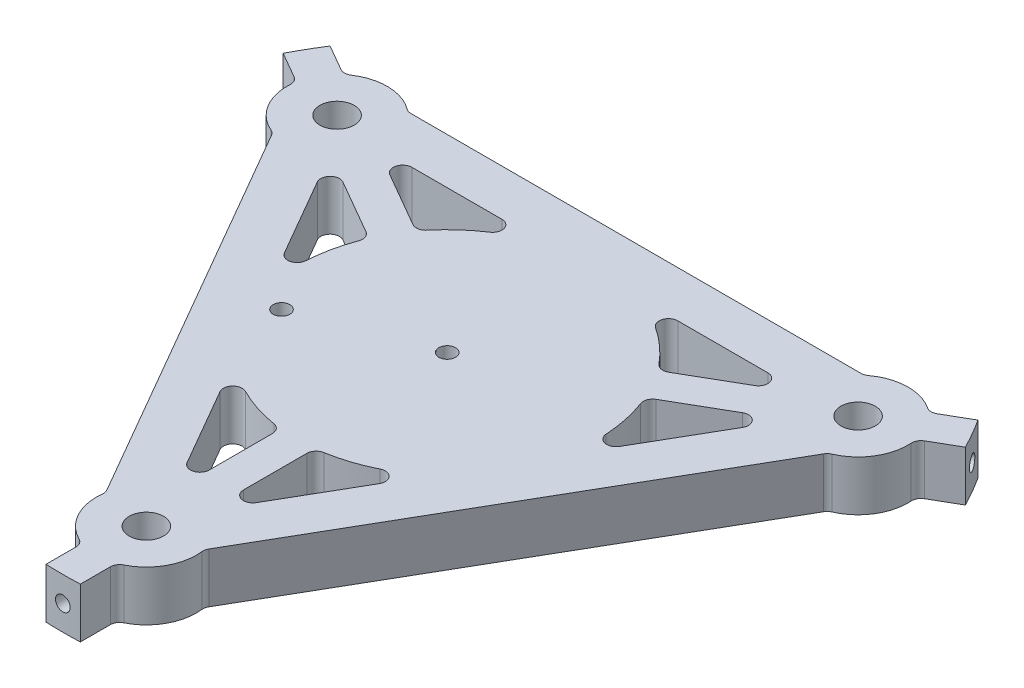
from build123d import *

# Parameters (mm, degrees)
SKETCH1_R               = 3.2639
SKETCH1_R_2             = 1.5875
BOSS_EXTRUDE1_DEPTH     = 4.7625
SKETCH3_R               = 1.397
CUT_EXTRUDE1_DEPTH      = 6.35
CIRPATTERN1_COUNT       = 3
CUT_EXTRUDE2_DEPTH      = 99.10069009
CUT_EXTRUDE2_DEPTH_BACK = 99.10069009
SKETCH4_R               = 1.5875


with BuildPart() as part:
    # Sketch1 → Boss-Extrude1 (new, symmetric)
    with BuildSketch(Plane(origin=(0, 0, 0), x_dir=(1, 0, 0), z_dir=(0, 1, 0))):
        with BuildLine():
            Line((-3.2639, -67.266177805), (-3.2639, -72.952022465))
            ThreePointArc((-3.2639, -72.952022465), (0, -73.025), (3.2639, -72.952022465))
            Line((3.2639, -72.952022465), (3.2639, -67.266177805))
            ThreePointArc((3.2639, -67.266177805), (3.530041907, -66.330459307), (4.248792135, -65.674868937))
            ThreePointArc((4.248792135, -65.674868937), (8.372836069, -61.691061677), (9.46261108, -56.061599084))
            ThreePointArc((9.46261108, -56.061599084), (9.488028557, -55.49728858), (9.68917198, -54.969430914))
            Line((9.68917198, -54.969430914), (52.449509593, 19.09364638))
            ThreePointArc((52.449509593, 19.09364638), (52.80607603, 19.531770528), (53.282074524, 19.835937961))
            ThreePointArc((53.282074524, 19.835937961), (57.612444634, 23.594442101), (59.000500957, 29.157872544))
            ThreePointArc((59.000500957, 29.157872544), (59.208883758, 30.108123685), (59.886168795, 30.806468587))
            Line((59.886168795, 30.806468587), (64.810254712, 33.649390917))
            ThreePointArc((64.810254712, 33.649390917), (63.241505111, 36.5125), (61.546354712, 39.302631548))
            Line((61.546354712, 39.302631548), (56.622268795, 36.459709218))
            ThreePointArc((56.622268795, 36.459709218), (55.678841851, 36.222335622), (54.751708822, 36.516996393))
            ThreePointArc((54.751708822, 36.516996393), (49.239608564, 38.096619576), (43.819463444, 36.225661123))
            ThreePointArc((43.819463444, 36.225661123), (43.318047473, 35.965518052), (42.760337613, 35.875784533))
            Line((42.760337613, 35.875784533), (-42.760337613, 35.875784533))
            ThreePointArc((-42.760337613, 35.875784533), (-43.318047473, 35.965518052), (-43.819463444, 36.225661123))
            ThreePointArc((-43.819463444, 36.225661123), (-49.239608564, 38.096619576), (-54.751708822, 36.516996393))
            ThreePointArc((-54.751708822, 36.516996393), (-55.678841851, 36.222335622), (-56.622268795, 36.459709218))
            Line((-56.622268795, 36.459709218), (-61.546354712, 39.302631548))
            ThreePointArc((-61.546354712, 39.302631548), (-63.241505111, 36.5125), (-64.810254712, 33.649390917))
            Line((-64.810254712, 33.649390917), (-59.886168795, 30.806468587))
            ThreePointArc((-59.886168795, 30.806468587), (-59.208883758, 30.108123685), (-59.000500957, 29.157872544))
            ThreePointArc((-59.000500957, 29.157872544), (-57.612444634, 23.594442101), (-53.282074524, 19.835937961))
            ThreePointArc((-53.282074524, 19.835937961), (-52.80607603, 19.531770528), (-52.449509593, 19.09364638))
            Line((-52.449509593, 19.09364638), (-9.68917198, -54.969430914))
            ThreePointArc((-9.68917198, -54.969430914), (-9.488028557, -55.49728858), (-9.46261108, -56.061599084))
            ThreePointArc((-9.46261108, -56.061599084), (-8.372836069, -61.691061677), (-4.248792135, -65.674868937))
            ThreePointArc((-4.248792135, -65.674868937), (-3.530041907, -66.330459307), (-3.2639, -67.266177805))
        make_face()
        with Locations((0, -57.15)):
            Circle(SKETCH1_R, mode=Mode.SUBTRACT)
        with Locations((-49.493351826, 28.575)):
            Circle(SKETCH1_R, mode=Mode.SUBTRACT)
        with Locations((49.493351826, 28.575)):
            Circle(SKETCH1_R, mode=Mode.SUBTRACT)
        Circle(SKETCH1_R_2, mode=Mode.SUBTRACT)
        with BuildLine():
            Line((3.2639, -41.947085229), (3.2639, -29.931318938))
            ThreePointArc((3.2639, -29.931318938), (3.684254787, -28.783240772), (4.746558577, -28.178019921))
            ThreePointArc((4.746558577, -28.178019921), (8.86834191, -27.164004432), (12.794439011, -25.550595989))
            ThreePointArc((12.794439011, -25.550595989), (14.884524009, -25.921032832), (15.130330606, -28.029410851))
            Line((15.130330606, -28.029410851), (6.581693168, -42.836085229))
            ThreePointArc((6.581693168, -42.836085229), (4.581719738, -43.664501348), (3.2639, -41.947085229))
        make_face(mode=Mode.SUBTRACT)
        with BuildLine():
            Line((-3.2639, -41.947085229), (-3.2639, -29.931318938))
            ThreePointArc((-3.2639, -29.931318938), (-3.684254787, -28.783240772), (-4.746558577, -28.178019921))
            ThreePointArc((-4.746558577, -28.178019921), (-8.86834191, -27.164004432), (-12.794439011, -25.550595989))
            ThreePointArc((-12.794439011, -25.550595989), (-14.884524009, -25.921032832), (-15.130330606, -28.029410851))
            Line((-15.130330606, -28.029410851), (-6.581693168, -42.836085229))
            ThreePointArc((-6.581693168, -42.836085229), (-4.581719738, -43.664501348), (-3.2639, -41.947085229))
        make_face(mode=Mode.SUBTRACT)
        with BuildLine():
            Line((-34.695291423, 23.80016293), (-24.289332569, 17.792279785))
            ThreePointArc((-24.289332569, 17.792279785), (-23.084890319, 17.582278626), (-22.029601791, 18.199650269))
            ThreePointArc((-22.029601791, 18.199650269), (-19.090546952, 21.262211599), (-15.730245703, 23.855607205))
            ThreePointArc((-15.730245703, 23.855607205), (-15.00601092, 25.850892331), (-16.709016547, 27.117956098))
            Line((-16.709016547, 27.117956098), (-33.806291423, 27.117956098))
            ThreePointArc((-33.806291423, 27.117956098), (-35.523707542, 25.80013636), (-34.695291423, 23.80016293))
        make_face(mode=Mode.SUBTRACT)
        with BuildLine():
            Line((-37.959191423, 18.146922299), (-27.553232569, 12.139039154))
            ThreePointArc((-27.553232569, 12.139039154), (-26.769145106, 11.200962147), (-26.776160369, 9.978369652))
            ThreePointArc((-26.776160369, 9.978369652), (-27.958888861, 5.901792833), (-28.524684714, 1.694988784))
            ThreePointArc((-28.524684714, 1.694988784), (-29.890534929, 0.070140501), (-31.839347153, 0.911454753))
            Line((-31.839347153, 0.911454753), (-40.387984591, 15.718129131))
            ThreePointArc((-40.387984591, 15.718129131), (-40.10542728, 17.864364988), (-37.959191423, 18.146922299))
        make_face(mode=Mode.SUBTRACT)
        with BuildLine():
            Line((37.959191423, 18.146922299), (27.553232569, 12.139039154))
            ThreePointArc((27.553232569, 12.139039154), (26.769145106, 11.200962147), (26.776160369, 9.978369652))
            ThreePointArc((26.776160369, 9.978369652), (27.958888861, 5.901792833), (28.524684714, 1.694988784))
            ThreePointArc((28.524684714, 1.694988784), (29.890534929, 0.070140501), (31.839347153, 0.911454753))
            Line((31.839347153, 0.911454753), (40.387984591, 15.718129131))
            ThreePointArc((40.387984591, 15.718129131), (40.10542728, 17.864364988), (37.959191423, 18.146922299))
        make_face(mode=Mode.SUBTRACT)
        with BuildLine():
            Line((34.695291423, 23.80016293), (24.289332569, 17.792279785))
            ThreePointArc((24.289332569, 17.792279785), (23.084890319, 17.582278626), (22.029601791, 18.199650269))
            ThreePointArc((22.029601791, 18.199650269), (19.090546952, 21.262211599), (15.730245703, 23.855607205))
            ThreePointArc((15.730245703, 23.855607205), (15.00601092, 25.850892331), (16.709016547, 27.117956098))
            Line((16.709016547, 27.117956098), (33.806291423, 27.117956098))
            ThreePointArc((33.806291423, 27.117956098), (35.523707542, 25.80013636), (34.695291423, 23.80016293))
        make_face(mode=Mode.SUBTRACT)
    extrude(amount=BOSS_EXTRUDE1_DEPTH, both=True)

    # Sketch3 → Cut-Extrude1 (cut)
    with BuildSketch(Plane.XY.offset(73.025)):
        Circle(SKETCH3_R)
    cut_extrude1 = extrude(amount=-CUT_EXTRUDE1_DEPTH, mode=Mode.SUBTRACT)

    # CirPattern1: Cut-Extrude1 ×3 about axis
    cirpattern1_axis = Axis((0, 4.7625, 0), (0, -1, 0))
    for i in range(1, CIRPATTERN1_COUNT):
        add(cut_extrude1.rotate(cirpattern1_axis, i * 360 / CIRPATTERN1_COUNT), mode=Mode.SUBTRACT)

    # Sketch4 → Cut-Extrude2 (cut, two sides: drawn at the far end of the back side and taken through both)
    with BuildSketch(Plane.XZ.offset(4.7625).offset(-CUT_EXTRUDE2_DEPTH_BACK)):
        with Locations((-22.820992584, 8.65138408)):
            Circle(SKETCH4_R)
    extrude(amount=CUT_EXTRUDE2_DEPTH + CUT_EXTRUDE2_DEPTH_BACK, mode=Mode.SUBTRACT)


solid = part.part
